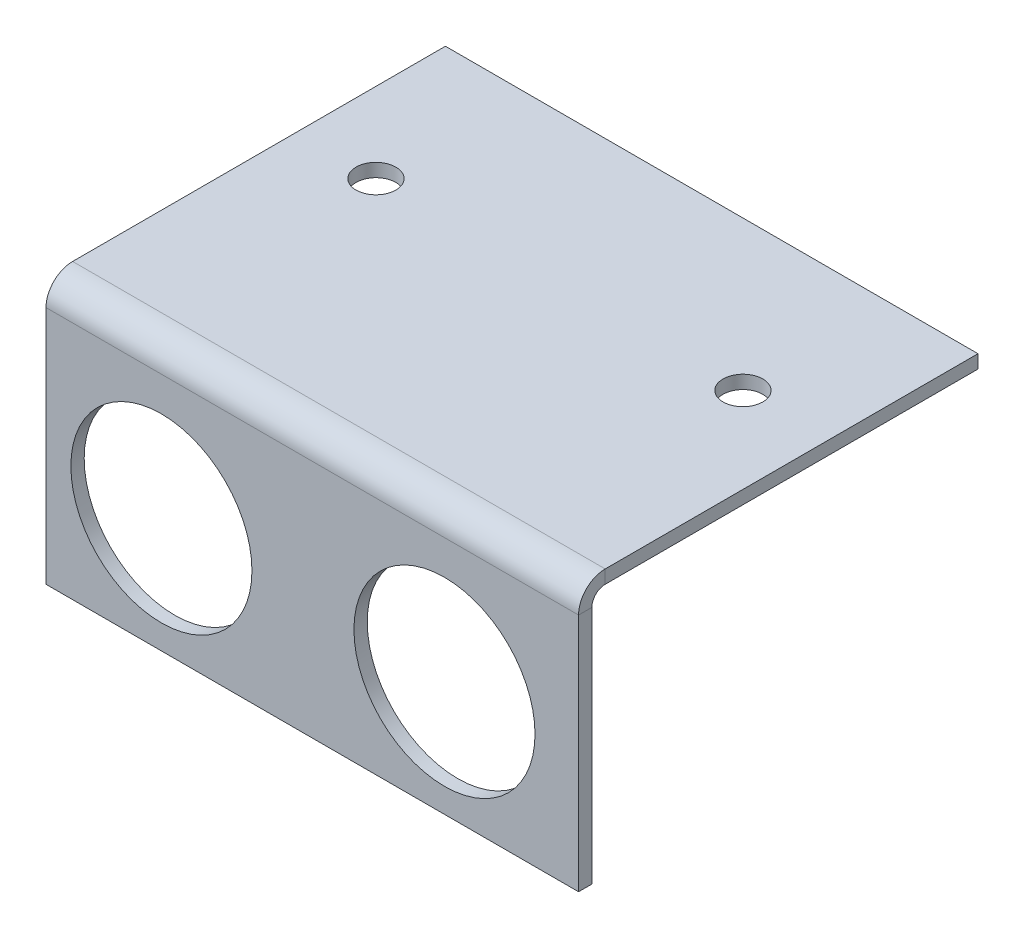
from build123d import *

# Parameters (mm, degrees)
BOSS_EXTRUDE1_DEPTH    = 50.8
SKETCH2_R              = 8.636
CUT_EXTRUDE1_DEPTH     = 88.642940525
CONVERT_SOLID1_START   = -75.861380996
CONVERT_SOLID1_DEPTH   = 50.8
CONVERT_SOLID1_2_DEPTH = 50.8
SKETCH7_R              = 1.89865
CUT_EXTRUDE2_DEPTH     = 129.109840672


# Read off the part's stored shape, not the designer's step: Convert-Solid1
with BuildPart() as part:
    # Sketch1 → Boss-Extrude1 (new body)
    with BuildSketch(Plane(origin=(-25.061380996, 0, 0), x_dir=(0, 0, -1), z_dir=(1, 0, 0))):
        Polygon((63.543927145, -3.611794537), (63.543927145, 20.518205463), (100.373927145, 20.518205463), (100.373927145, 21.788205463), (62.273927145, 21.788205463), (62.273927145, -3.611794537), align=None)
    extrude(amount=-BOSS_EXTRUDE1_DEPTH)

    # Sketch2 → Cut-Extrude1 (cut, through all)
    with BuildSketch(Plane.XY.offset(-62.273927145)):
        with Locations((-64.852637296, 7.338590118)):
            Circle(SKETCH2_R)
        with Locations((-37.852637296, 7.338590118)):
            Circle(SKETCH2_R)
    extrude(amount=-CUT_EXTRUDE1_DEPTH, mode=Mode.SUBTRACT)

    # Convert-Solid1 outline → Convert-Solid1 (cut)
    with BuildSketch(Plane.YZ.offset(CONVERT_SOLID1_START)):
        with BuildLine():
            Line((21.788205463, -62.273927145), (19.248205463, -62.273927145))
            ThreePointArc((19.248205463, -62.273927145), (21.044256687, -63.01787592), (21.788205463, -64.813927145))
            Line((21.788205463, -64.813927145), (21.788205463, -62.273927145))
        make_face()
    extrude(amount=CONVERT_SOLID1_DEPTH, mode=Mode.SUBTRACT)

    # Convert-Solid1 2 outline → Convert-Solid1 2 (add)
    with BuildSketch(Plane.YZ.offset(CONVERT_SOLID1_START)):
        with BuildLine():
            Line((20.518205463, -63.543927145), (19.248205463, -63.543927145))
            ThreePointArc((19.248205463, -63.543927145), (20.146231075, -63.915901533), (20.518205463, -64.813927145))
            Line((20.518205463, -64.813927145), (20.518205463, -63.543927145))
        make_face()
    extrude(amount=CONVERT_SOLID1_2_DEPTH)

    # Sketch7 → Cut-Extrude2 (cut, through all)
    with BuildSketch(Plane(origin=(0, 20.518205463, 0), x_dir=(-1, 0, 0), z_dir=(0, -1, 0))):
        with Locations(Location((68.241380996, 86.126775189, 0), (0, 0, 90))):
            Circle(SKETCH7_R)
        with Locations(Location((33.236646392, 86.126775189, 0), (0, 0, 90))):
            Circle(SKETCH7_R)
    extrude(amount=-CUT_EXTRUDE2_DEPTH, mode=Mode.SUBTRACT)


solid = part.part
